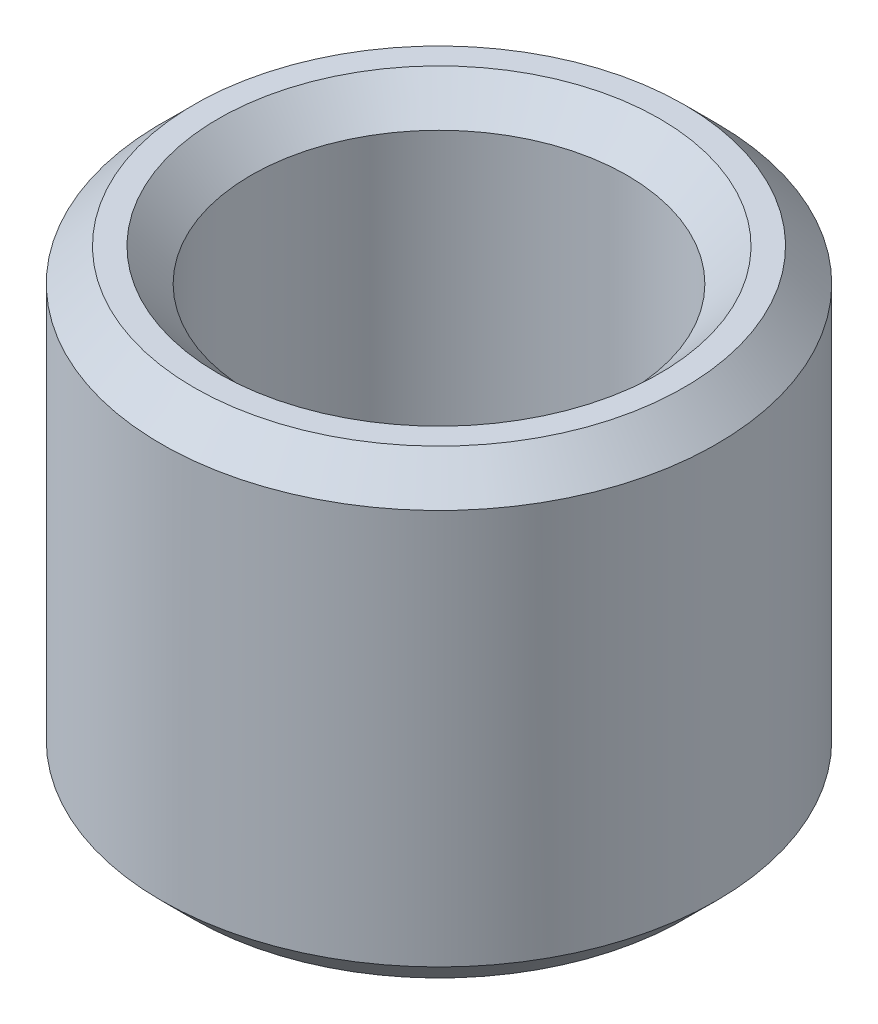
from build123d import *

# Parameters (mm, degrees)
SKETCH1_R           = 7.5
BOSS_EXTRUDE1_DEPTH = 12.439810218
SKETCH2_R           = 5.077730475
CUT_EXTRUDE1_DEPTH  = 17.347748416
CHAMFER1_SIZE       = 0.881765308


with BuildPart() as part:
    # Sketch1 → Boss-Extrude1 (new body)
    with BuildSketch(Plane(origin=(0, 0, 0), x_dir=(1, 0, 0), z_dir=(0, 1, 0))):
        Circle(SKETCH1_R)
    extrude(amount=BOSS_EXTRUDE1_DEPTH)

    # Sketch2 → Cut-Extrude1 (cut, through all)
    with BuildSketch(Plane(origin=(0, 0, 0), x_dir=(1, 0, 0), z_dir=(0, 1, 0))):
        Circle(SKETCH2_R)
    extrude(amount=CUT_EXTRUDE1_DEPTH, mode=Mode.SUBTRACT)

    # Chamfer1
    chamfer1_edges = [part.edges().sort_by_distance(p)[0] for p in [
        (-5.077730475, 12.439810218, 0),
        (-5.077730475, 0, 0),
        (-7.5, 0, 0),
        (-7.5, 12.439810218, 0),
    ]]
    chamfer(chamfer1_edges, length=CHAMFER1_SIZE)


solid = part.part
